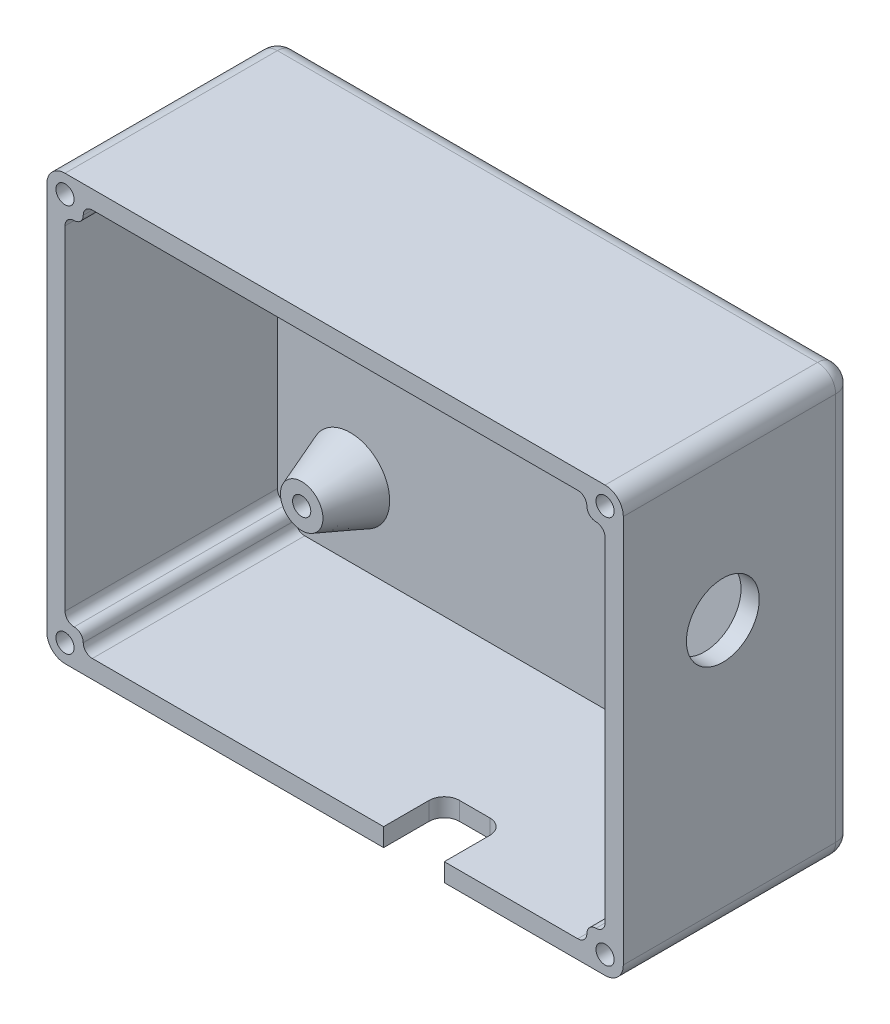
from build123d import *

# Parameters (mm, degrees)
SKETCH_1_W          = 95
SKETCH_1_H          = 70
EXTRUDE_1_DEPTH     = 3
SKETCH_2_R          = 3.5
EXTRUDE_2_DEPTH     = 8
SKETCH_3_R          = 1.5
CUT_EXTRUDE_1_DEPTH = 8
CHAMFER_2_SIZE      = 3
CHAMFER_2_SIZE_2    = 8
SKETCH_6_W          = 95
SKETCH_6_H          = 70
SKETCH_6_W_2        = 89
SKETCH_6_H_2        = 64
EXTRUDE_3_DEPTH     = 35
SKETCH_8_W          = 6
SKETCH_8_H          = 6
EXTRUDE_4_DEPTH     = 35
FILLET_4_R          = 1.5
SKETCH_10_R         = 1.5
CUT_EXTRUDE_2_DEPTH = 15
FILLET_6_R          = 3
SKETCH_11_R         = 6
CUT_EXTRUDE_3_DEPTH = 15
SKETCH_12_W         = 10
SKETCH_12_H         = 10
CUT_EXTRUDE_4_DEPTH = 15
FILLET_9_R          = 2.5
FILLET_10_R         = 3


# Some blends are built 0.0001 mm under size
with BuildPart() as part:
    # ｽｹｯﾁ1 → ﾎﾞｽ - 押し出し1 (new body)
    with BuildSketch(Plane.XY):
        with Locations((47.5, 35)):
            Rectangle(SKETCH_1_W, SKETCH_1_H)
    extrude(amount=EXTRUDE_1_DEPTH)

    # ｽｹｯﾁ2 → ﾎﾞｽ - 押し出し2 (add)
    with BuildSketch(Plane.XY.offset(3)):
        with Locations(Location((15, 55, 0), (0, 0, 180))):
            Circle(SKETCH_2_R)
        with Locations(Location((15, 15, 0), (0, 0, 180))):
            Circle(SKETCH_2_R)
        with Locations(Location((80, 55, 0), (0, 0, 180))):
            Circle(SKETCH_2_R)
        with Locations(Location((80, 15, 0), (0, 0, 180))):
            Circle(SKETCH_2_R)
    extrude(amount=EXTRUDE_2_DEPTH)

    # ｽｹｯﾁ3 → ｶｯﾄ - 押し出し1 (cut)
    with BuildSketch(Plane.XY.offset(11)):
        with Locations((15, 55)):
            Circle(SKETCH_3_R)
        with Locations((80, 55)):
            Circle(SKETCH_3_R)
        with Locations((15, 15)):
            Circle(SKETCH_3_R)
        with Locations((80, 15)):
            Circle(SKETCH_3_R)
    extrude(amount=-CUT_EXTRUDE_1_DEPTH, mode=Mode.SUBTRACT)

    # 面取り2
    # the kernel refuses this chamfer: 8, 3 mm, written as the material it adds along each edge
    with BuildSketch(Plane(origin=(15, 55, 3), x_dir=(-1, 0, 0), z_dir=(0, 1, 0))) as chamfer_2_piece_1_section:
        Polygon((3.5 + CHAMFER_2_SIZE, 0), (3.5, CHAMFER_2_SIZE_2), (3.5, 0), align=None)
    chamfer_2_piece_1 = revolve(axis=Axis((15, 55, 3), (0, 0, 1)), mode=Mode.PRIVATE)
    chamfer_2_piece_1 = split(chamfer_2_piece_1, bisect_by=Plane(origin=(19.987700919, 55, 11), z_dir=(0, 0, -1)), keep=Keep.TOP, mode=Mode.PRIVATE)
    add(chamfer_2_piece_1)
    with BuildSketch(Plane(origin=(15, 15, 3), x_dir=(-1, 0, 0), z_dir=(0, 1, 0))) as chamfer_2_piece_2_section:
        Polygon((3.5 + CHAMFER_2_SIZE, 0), (3.5, CHAMFER_2_SIZE_2), (3.5, 0), align=None)
    chamfer_2_piece_2 = revolve(axis=Axis((15, 15, 3), (0, 0, 1)), mode=Mode.PRIVATE)
    chamfer_2_piece_2 = split(chamfer_2_piece_2, bisect_by=Plane(origin=(19.987700919, 15, 11), z_dir=(0, 0, -1)), keep=Keep.TOP, mode=Mode.PRIVATE)
    add(chamfer_2_piece_2)
    with BuildSketch(Plane(origin=(80, 55, 3), x_dir=(-1, 0, 0), z_dir=(0, 1, 0))) as chamfer_2_piece_3_section:
        Polygon((3.5 + CHAMFER_2_SIZE, 0), (3.5, CHAMFER_2_SIZE_2), (3.5, 0), align=None)
    chamfer_2_piece_3 = revolve(axis=Axis((80, 55, 3), (0, 0, 1)), mode=Mode.PRIVATE)
    chamfer_2_piece_3 = split(chamfer_2_piece_3, bisect_by=Plane(origin=(84.987700919, 55, 11), z_dir=(0, 0, -1)), keep=Keep.TOP, mode=Mode.PRIVATE)
    add(chamfer_2_piece_3)
    with BuildSketch(Plane(origin=(80, 15, 3), x_dir=(-1, 0, 0), z_dir=(0, 1, 0))) as chamfer_2_piece_4_section:
        Polygon((3.5 + CHAMFER_2_SIZE, 0), (3.5, CHAMFER_2_SIZE_2), (3.5, 0), align=None)
    chamfer_2_piece_4 = revolve(axis=Axis((80, 15, 3), (0, 0, 1)), mode=Mode.PRIVATE)
    chamfer_2_piece_4 = split(chamfer_2_piece_4, bisect_by=Plane(origin=(84.987700919, 15, 11), z_dir=(0, 0, -1)), keep=Keep.TOP, mode=Mode.PRIVATE)
    add(chamfer_2_piece_4)

    # ｽｹｯﾁ6 → ﾎﾞｽ - 押し出し3 (add)
    with BuildSketch(Plane.XY.offset(3)):
        with Locations((47.5, 35)):
            Rectangle(SKETCH_6_W, SKETCH_6_H)
        with Locations((47.5, 35)):
            Rectangle(SKETCH_6_W_2, SKETCH_6_H_2, mode=Mode.SUBTRACT)
    extrude(amount=EXTRUDE_3_DEPTH)

    # ｽｹｯﾁ8 → ﾎﾞｽ - 押し出し4 (add)
    with BuildSketch(Plane.XY.offset(38)):
        with Locations((3, 67)):
            Rectangle(SKETCH_8_W, SKETCH_8_H)
        with Locations((92, 67)):
            Rectangle(SKETCH_8_W, SKETCH_8_H)
        with Locations((3, 3)):
            Rectangle(SKETCH_8_W, SKETCH_8_H)
        with Locations((92, 3)):
            Rectangle(SKETCH_8_W, SKETCH_8_H)
    extrude(amount=-EXTRUDE_4_DEPTH)

    # ﾌｨﾚｯﾄ4
    fillet_4_edges = [part.edges().sort_by_distance(p)[0] for p in [
        (92, 6, 20.5),
        (89, 6, 20.5),
        (89, 3, 20.5),
        (6, 3, 20.5),
        (6, 6, 20.5),
        (3, 6, 20.5),
        (92, 64, 20.5),
        (89, 64, 20.5),
        (89, 67, 20.5),
        (6, 64, 20.5),
        (6, 67, 20.5),
        (3, 64, 20.5),
    ]]
    fillet(fillet_4_edges, radius=FILLET_4_R - 0.0001)  # a hair under: the kernel refuses the full size

    # ｽｹｯﾁ10 → ｶｯﾄ - 押し出し2 (cut)
    with BuildSketch(Plane.XY.offset(38)):
        with Locations((3, 67)):
            Circle(SKETCH_10_R)
        with Locations((92, 67)):
            Circle(SKETCH_10_R)
        with Locations((3, 3)):
            Circle(SKETCH_10_R)
        with Locations((92, 3)):
            Circle(SKETCH_10_R)
    extrude(amount=-CUT_EXTRUDE_2_DEPTH, mode=Mode.SUBTRACT)

    # ﾌｨﾚｯﾄ6
    fillet_6_edges = [part.edges().sort_by_distance(p)[0] for p in [
        (0, 70, 19),
        (95, 70, 19),
        (95, 0, 19),
        (0, 0, 19),
    ]]
    fillet(fillet_6_edges, radius=FILLET_6_R)

    # ｽｹｯﾁ11 → ｶｯﾄ - 押し出し3 (cut)
    with BuildSketch(Plane(origin=(95, 0, 0), x_dir=(0, 0, -1), z_dir=(1, 0, 0))):
        with Locations((-21.599978, 44)):
            Circle(SKETCH_11_R)
    extrude(amount=-CUT_EXTRUDE_3_DEPTH, mode=Mode.SUBTRACT)

    # ｽｹｯﾁ12 → ｶｯﾄ - 押し出し4 (cut)
    with BuildSketch(Plane.XZ):
        with Locations((60.5, 33)):
            Rectangle(SKETCH_12_W, SKETCH_12_H)
    extrude(amount=-CUT_EXTRUDE_4_DEPTH, mode=Mode.SUBTRACT)

    # ﾌｨﾚｯﾄ9
    fillet_9_edges = [part.edges().sort_by_distance(p)[0] for p in [
        (65.5, 1.5, 28),
        (55.5, 1.5, 28),
    ]]
    fillet(fillet_9_edges, radius=FILLET_9_R)

    # ﾌｨﾚｯﾄ10
    fillet_10_edges = [part.edges().sort_by_distance(p)[0] for p in [
        (47.5, 0, 0),
        (0, 35, 0),
        (47.5, 70, 0),
        (95, 35, 0),
        (0.878679656, 69.121320344, 0),
        (94.121320344, 69.121320344, 0),
        (94.121320344, 0.878679656, 0),
        (0.878679656, 0.878679656, 0),
    ]]
    fillet(fillet_10_edges, radius=FILLET_10_R)


solid = part.part
